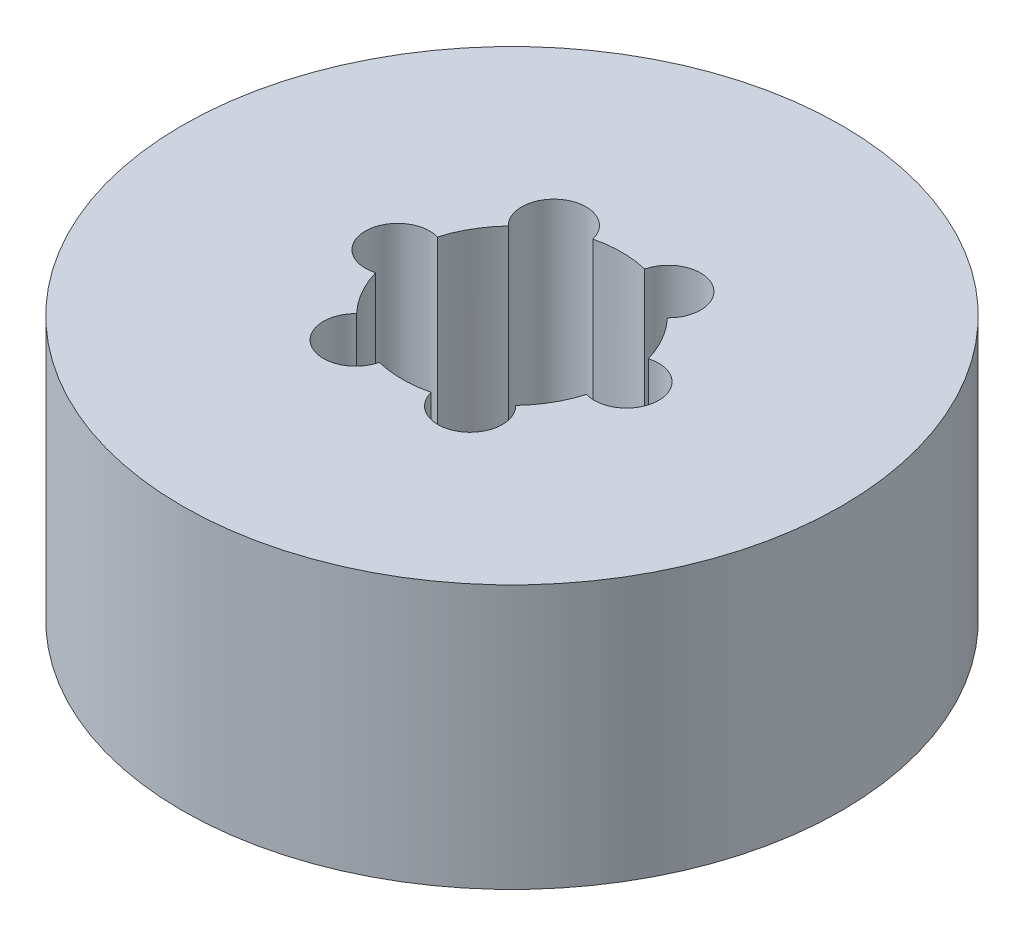
from build123d import *

# Parameters (mm, degrees)
SKETCH1_R           = 30
BOSS_EXTRUDE1_DEPTH = 24
SKETCH2_R           = 10
CUT_EXTRUDE1_DEPTH  = 49.744230428
SKETCH3_R           = 2.931553515
CUT_EXTRUDE2_DEPTH  = 20.87483626
CIRPATTERN1_COUNT   = 6


with BuildPart() as part:
    # Sketch1 → Boss-Extrude1 (new body)
    with BuildSketch(Plane(origin=(0, 0, 0), x_dir=(1, 0, 0), z_dir=(0, 1, 0))):
        Circle(SKETCH1_R)
    extrude(amount=BOSS_EXTRUDE1_DEPTH)

    # Sketch2 → Cut-Extrude1 (cut, through all)
    with BuildSketch(Plane(origin=(0, 0, 0), x_dir=(1, 0, 0), z_dir=(0, 1, 0))):
        Circle(SKETCH2_R)
    extrude(amount=CUT_EXTRUDE1_DEPTH, mode=Mode.SUBTRACT)

    # Sketch3 → Cut-Extrude2 (cut)
    with BuildSketch(Plane(origin=(0, 24, 0), x_dir=(1, 0, 0), z_dir=(0, 1, 0))):
        with Locations((-10.417109361, 0)):
            Circle(SKETCH3_R)
    cut_extrude2 = extrude(amount=-CUT_EXTRUDE2_DEPTH, mode=Mode.SUBTRACT)

    # CirPattern1: Cut-Extrude2 ×6 about axis
    cirpattern1_axis = Axis((0, 0, 0), (0, 1, 0))
    for i in range(1, CIRPATTERN1_COUNT):
        add(cut_extrude2.rotate(cirpattern1_axis, i * 360 / CIRPATTERN1_COUNT), mode=Mode.SUBTRACT)


solid = part.part
